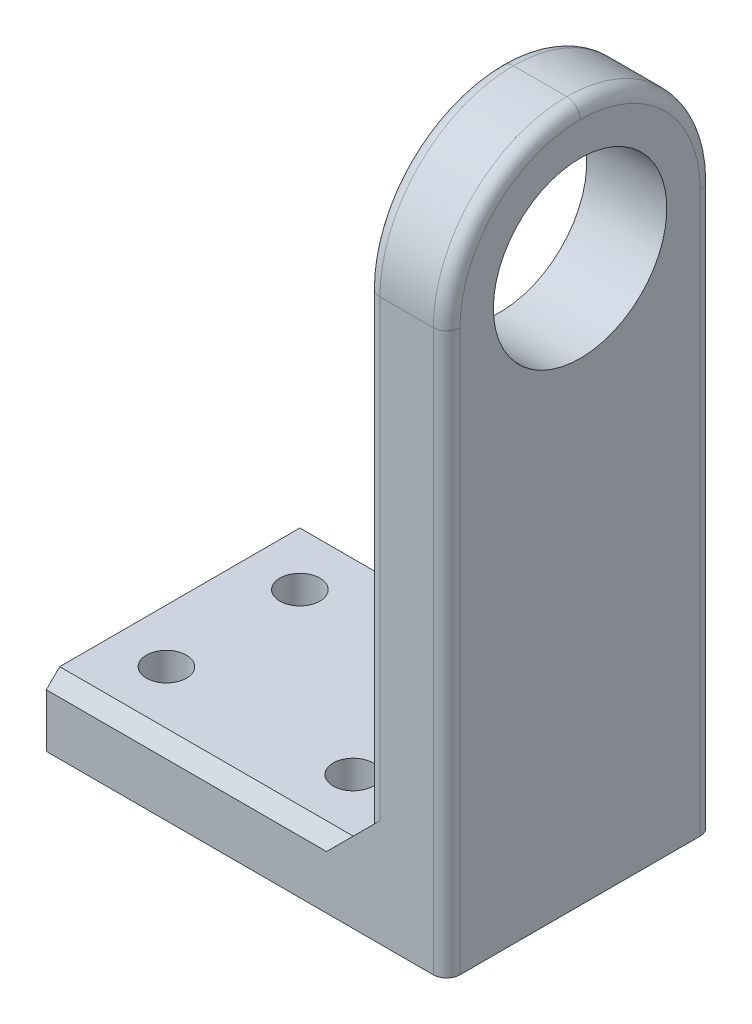
from build123d import *

# Parameters (mm, degrees)
SKETCH1_W            = 150
SKETCH1_H            = 20
BOSS_EXTRUDE1_DEPTH  = 5
SKETCH2_W            = 20
SKETCH2_H            = 47
SKETCH2_R            = 6.5
BOSS_EXTRUDE2_DEPTH  = 6
FILLET1_R            = 10
FILLET1_OF_MIRROR1_R = 10
CHAMFER1_SIZE        = 2
FILLET2_R            = 1
CHAMFER2_SIZE        = 1
SKETCH3_W            = 35.580310247
SKETCH3_H            = 66.117820845
CUT_EXTRUDE1_DEPTH   = 120
SKETCH4_R            = 1.5
CUT_EXTRUDE2_DEPTH   = 10


with BuildPart() as part:
    # Sketch1 → Boss-Extrude1 (new body)
    with BuildSketch(Plane(origin=(0, 0, 0), x_dir=(1, 0, 0), z_dir=(0, 1, 0))):
        Rectangle(SKETCH1_W, SKETCH1_H)
    extrude(amount=BOSS_EXTRUDE1_DEPTH)

    # Sketch2 → Boss-Extrude2 (add)
    with BuildSketch(Plane.ZY.offset(75)):
        with Locations((0, 28.5)):
            Rectangle(SKETCH2_W, SKETCH2_H)
        with Locations((0, 42)):
            Circle(SKETCH2_R, mode=Mode.SUBTRACT)
    boss_extrude2 = extrude(amount=-BOSS_EXTRUDE2_DEPTH)

    # Fillet1
    fillet1_edges = [part.edges().sort_by_distance(p)[0] for p in [
        (-72, 52, -10),
        (-72, 52, 10),
    ]]
    fillet(fillet1_edges, radius=FILLET1_R - 0.0001)  # a hair under: the kernel refuses the full size

    # Mirror1: Boss-Extrude2 across plane
    add(boss_extrude2.mirror(Plane(origin=(0, 0, 0), x_dir=(0, 0, 1), z_dir=(1, 0, 0))))

    # Fillet1 of Mirror1
    fillet1_of_mirror1_edges = [part.edges().sort_by_distance(p)[0] for p in [
        (72, 52, -10),
        (72, 52, 10),
    ]]
    fillet(fillet1_of_mirror1_edges, radius=FILLET1_OF_MIRROR1_R - 0.0001)  # a hair under: the kernel refuses the full size

    # Chamfer1
    chamfer1_edges = [part.edges().sort_by_distance(p)[0] for p in [
        (-69, 5, 0),
        (69, 5, 0),
    ]]
    chamfer(chamfer1_edges, length=CHAMFER1_SIZE)

    # Fillet2
    fillet2_edges = [part.edges().sort_by_distance(p)[0] for p in [
        (-75, 21.00005, 10),
        (-75, 21.00005, -10),
        (-75, 49.071097101, 7.071097101),
        (-75, 49.071097101, -7.071097101),
        (-69, 24.50005, -10),
        (-69, 49.071097101, 7.071097101),
        (-69, 49.071097101, -7.071097101),
        (69, 24.50005, -10),
        (75, 21.00005, -10),
        (75, 21.00005, 10),
        (75, 49.071097101, 7.071097101),
        (75, 49.071097101, -7.071097101),
        (69, 49.071097101, 7.071097101),
        (69, 49.071097101, -7.071097101),
        (-69, 24.50005, 10),
        (69, 24.50005, 10),
    ]]
    fillet(fillet2_edges, radius=FILLET2_R)

    # Chamfer2
    chamfer2_edges = [part.edges().sort_by_distance(p)[0] for p in [
        (0, 5, -10),
        (0, 5, 10),
    ]]
    chamfer(chamfer2_edges, length=CHAMFER2_SIZE)

    # Sketch3 → Cut-Extrude1 (cut)
    with BuildSketch(Plane.ZY.offset(75)):
        with Locations((0.077756878, 33.058910422)):
            Rectangle(SKETCH3_W, SKETCH3_H)
    extrude(amount=-CUT_EXTRUDE1_DEPTH, mode=Mode.SUBTRACT)

    # Sketch4 → Cut-Extrude2 (cut)
    with BuildSketch(Plane(origin=(0, 5, 0), x_dir=(1, 0, 0), z_dir=(0, 1, 0))):
        with Locations(Location((49, 5, 0), (0, 0, 270))):
            Circle(SKETCH4_R)
        with Locations(Location((49, -5, 0), (0, 0, 270))):
            Circle(SKETCH4_R)
        with Locations(Location((63, -5, 0), (0, 0, 270))):
            Circle(SKETCH4_R)
        with Locations(Location((63, 5, 0), (0, 0, 270))):
            Circle(SKETCH4_R)
    extrude(amount=-CUT_EXTRUDE2_DEPTH, mode=Mode.SUBTRACT)


solid = part.part
